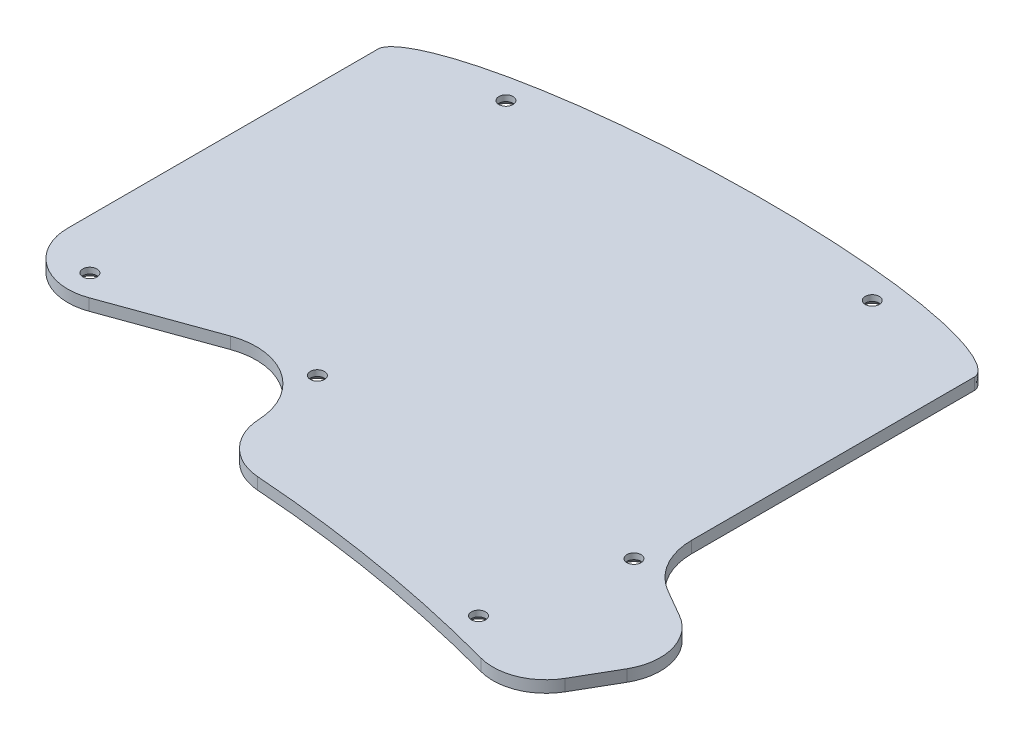
from build123d import *

# Parameters (mm, degrees)
BOSS_EXTRUDE1_DEPTH                            = 2
CSK_FOR_M2_FLAT_HEAD_MACHINE_SCREW2_AT_2_COUNT = 2
CSK_FOR_M2_FLAT_HEAD_MACHINE_SCREW2_AT_2_PITCH = 60.71715783
CSK_FOR_M2_FLAT_HEAD_MACHINE_SCREW2_AT_3_COUNT = 2
CSK_FOR_M2_FLAT_HEAD_MACHINE_SCREW2_AT_3_PITCH = 94.415886592
CSK_FOR_M2_FLAT_HEAD_MACHINE_SCREW2_AT_4_COUNT = 2
CSK_FOR_M2_FLAT_HEAD_MACHINE_SCREW2_AT_4_PITCH = 68.646308598
CSK_FOR_M2_FLAT_HEAD_MACHINE_SCREW2_AT_5_COUNT = 2
CSK_FOR_M2_FLAT_HEAD_MACHINE_SCREW2_AT_5_PITCH = 81.128678366
CSK_FOR_M2_FLAT_HEAD_MACHINE_SCREW2_AT_6_COUNT = 2
CSK_FOR_M2_FLAT_HEAD_MACHINE_SCREW2_AT_6_PITCH = 61.04624463


with BuildPart() as part:
    # Sketch1 → Boss-Extrude1 (new body)
    with BuildSketch(Plane(origin=(0, -18, 0), x_dir=(-1, 0, 0), z_dir=(0, -1, 0))):
        with BuildLine():
            Line((101.730615166, 14.278708172), (101.730615166, 67.138668169))
            add(Edge.make_bspline(
                [(101.730615166, 67.138668169), (101.735250856, 67.275115571), (101.713390966, 67.410853841), (101.633067165, 67.668568345), (101.575943762, 67.790415694), (101.372266606, 68.142605821), (101.199050454, 68.35209953), (100.823600333, 68.73987033), (100.621626657, 68.91640552), (100.200752158, 69.248864107), (99.981555205, 69.4045279), (99.306020246, 69.849053581), (98.836934468, 70.112892412), (97.877227791, 70.60318759), (97.388248328, 70.828061244), (95.903014167, 71.461712841), (94.889908109, 71.8297132), (92.84420924, 72.500797549), (91.810189071, 72.803249694), (88.691987496, 73.64074601), (86.588446512, 74.108153002), (82.363129011, 74.930812273), (80.23840048, 75.28499058), (73.849740033, 76.220505361), (69.565842948, 76.677808339), (60.985265325, 77.35347005), (56.684044098, 77.570000099), (48.079283608, 77.782221024), (43.778248843, 77.778001783), (37.328917876, 77.5895358), (35.179515146, 77.496024517), (30.881566022, 77.238782186), (28.735526018, 77.075301003), (24.458229251, 76.663778997), (22.325886522, 76.416107346), (18.078385438, 75.806547795), (15.962972556, 75.446351614), (12.810643947, 74.767871486), (11.76337701, 74.518387043), (9.679226408, 73.950405555), (8.640851682, 73.63218254), (7.121659224, 73.074949932), (6.620981384, 72.875527364), (5.636459764, 72.436424079), (5.152330354, 72.197426437), (4.447748092, 71.787245869), (4.215675375, 71.641076345), (3.770440702, 71.328087125), (3.556445051, 71.161234247), (3.256558964, 70.885596087), (3.160158936, 70.789437239), (2.977470232, 70.584971563), (2.891265175, 70.476633482), (2.663759238, 70.135173542), (2.546954708, 69.876509698), (2.5375, 69.598218788)],
                knots=[0, 0, 0, 0, 0.00390625, 0.00390625, 0.0078125, 0.0078125, 0.015625, 0.015625, 0.0234375, 0.0234375, 0.03125, 0.03125, 0.046875, 0.046875, 0.0625, 0.0625, 0.09375, 0.09375, 0.125, 0.125, 0.1875, 0.1875, 0.25, 0.25, 0.375, 0.375, 0.5, 0.5, 0.625, 0.625, 0.6875, 0.6875, 0.75, 0.75, 0.8125, 0.8125, 0.875, 0.875, 0.90625, 0.90625, 0.9375, 0.9375, 0.953125, 0.953125, 0.96875, 0.96875, 0.9765625, 0.9765625, 0.984375, 0.984375, 0.98828125, 0.98828125, 0.9921875, 0.9921875, 1, 1, 1, 1], degree=3))
            Line((2.5375, 69.598218788), (2.5375, 21.383174783))
            ThreePointArc((2.5375, 21.383174783), (1.063470667, 15.882640004), (-2.96356961, 11.856277882))
            Line((-2.96356961, 11.856277882), (-7.606020535, 9.176652528))
            ThreePointArc((-7.606020535, 9.176652528), (-11.799966519, 3.712266146), (-10.901629499, -3.117206165))
            Line((-10.901629499, -3.117206165), (-7.061364098, -9.770465972))
            ThreePointArc((-7.061364098, -9.770465972), (-2.702134101, -13.589833364), (3.081788876, -13.959547339))
            ThreePointArc((3.081788876, -13.959547339), (25.794866758, -8.981326054), (48.881783112, -6.213495259))
            ThreePointArc((48.881783112, -6.213495259), (54.690504824, -3.515001844), (57.233571455, 2.36342709))
            ThreePointArc((57.233571455, 2.36342709), (62.105951354, 11.016634667), (71.9636238, 12.218458781))
            Line((71.9636238, 12.218458781), (89.669845612, 5.815157515))
            ThreePointArc((89.669845612, 5.815157515), (97.900386631, 6.911655641), (101.730615166, 14.278708172))
        make_face()
    extrude(amount=BOSS_EXTRUDE1_DEPTH)

    # Sketch7 → CSK for M2 Flat Head Machine Screw2 (revolve, cut)
    with BuildSketch(Plane(origin=(-22.5375, -20, -72.139784762), x_dir=(0, 0, -1), z_dir=(1, 0, 0))):
        Polygon((0, 0), (0, 2), (1.2, 2), (1.2, 1), (2.2, 0), align=None)
    csk_for_m2_flat_head_machine_screw2 = revolve(axis=Axis((-22.5375, -26.35, -72.139784762), (0, 1, 0)), mode=Mode.SUBTRACT)

    # CSK for M2 Flat Head Machine Screw2 at 2: CSK for M2 Flat Head Machine Screw2 ×2
    with Locations(*[Vector(-0.9996040219096323, 0, 0.02813893000964052) * (i * CSK_FOR_M2_FLAT_HEAD_MACHINE_SCREW2_AT_2_PITCH) for i in range(1, CSK_FOR_M2_FLAT_HEAD_MACHINE_SCREW2_AT_2_COUNT)]):
        add(csk_for_m2_flat_head_machine_screw2, mode=Mode.SUBTRACT)

    # CSK for M2 Flat Head Machine Screw2 at 3: CSK for M2 Flat Head Machine Screw2 ×2
    with Locations(*[Vector(-0.7487417395271838, 0, 0.6628618313719737) * (i * CSK_FOR_M2_FLAT_HEAD_MACHINE_SCREW2_AT_3_PITCH) for i in range(1, CSK_FOR_M2_FLAT_HEAD_MACHINE_SCREW2_AT_3_COUNT)]):
        add(csk_for_m2_flat_head_machine_screw2, mode=Mode.SUBTRACT)

    # CSK for M2 Flat Head Machine Screw2 at 4: CSK for M2 Flat Head Machine Screw2 ×2
    with Locations(*[Vector(-0.5272405159888823, 0, 0.8497160927626222) * (i * CSK_FOR_M2_FLAT_HEAD_MACHINE_SCREW2_AT_4_PITCH) for i in range(1, CSK_FOR_M2_FLAT_HEAD_MACHINE_SCREW2_AT_4_COUNT)]):
        add(csk_for_m2_flat_head_machine_screw2, mode=Mode.SUBTRACT)

    # CSK for M2 Flat Head Machine Screw2 at 5: CSK for M2 Flat Head Machine Screw2 ×2
    with Locations(*[Vector(0.16023926756585227, 0, 0.987078202134947) * (i * CSK_FOR_M2_FLAT_HEAD_MACHINE_SCREW2_AT_5_PITCH) for i in range(1, CSK_FOR_M2_FLAT_HEAD_MACHINE_SCREW2_AT_5_COUNT)]):
        add(csk_for_m2_flat_head_machine_screw2, mode=Mode.SUBTRACT)

    # CSK for M2 Flat Head Machine Screw2 at 6: CSK for M2 Flat Head Machine Screw2 ×2
    with Locations(*[Vector(0.2915822276671845, 0, 0.9565457670747607) * (i * CSK_FOR_M2_FLAT_HEAD_MACHINE_SCREW2_AT_6_PITCH) for i in range(1, CSK_FOR_M2_FLAT_HEAD_MACHINE_SCREW2_AT_6_COUNT)]):
        add(csk_for_m2_flat_head_machine_screw2, mode=Mode.SUBTRACT)


solid = part.part
